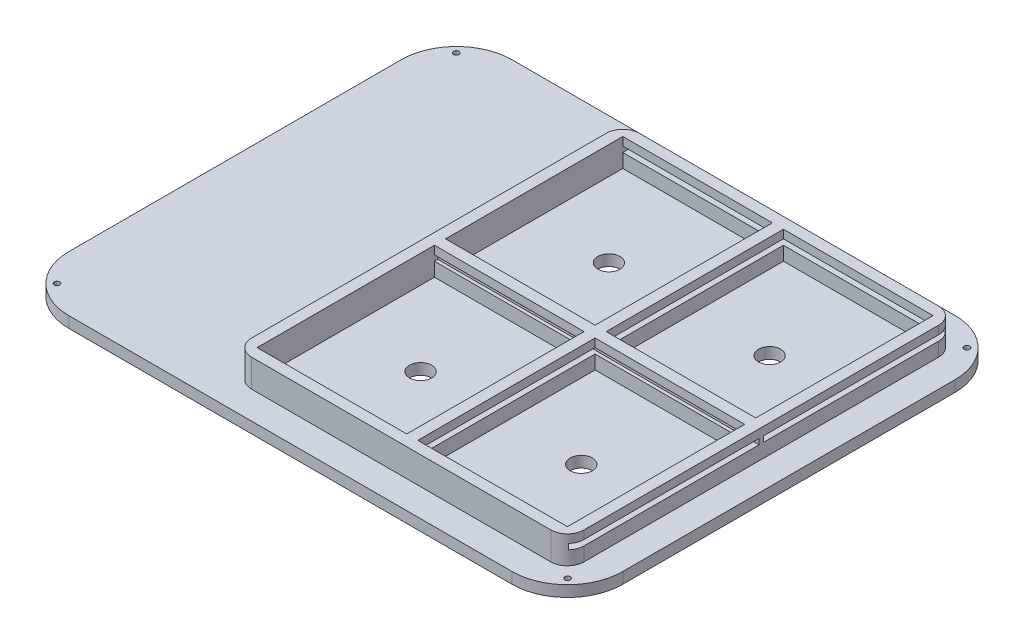
from build123d import *

# Parameters (mm, degrees)
SKETCH1_W           = 127
SKETCH1_H           = 101.6
BOSS_EXTRUDE1_DEPTH = 2.54
SKETCH2_W           = 76.2
SKETCH2_H           = 88.9
SKETCH2_W_2         = 34.29
SKETCH2_H_2         = 40.64
BOSS_EXTRUDE2_DEPTH = 6.35
SKETCH3_R           = 2.54
CUT_EXTRUDE1_DEPTH  = 163.763271348
CUT_EXTRUDE2_REACH  = 159.981
SKETCH4_W           = 42.672
SKETCH4_H           = 1.267041817
FILLET1_R           = 3.81
FILLET2_R           = 12.7
SKETCH5_R           = 0.635
CUT_EXTRUDE3_DEPTH  = 163.763271348


with BuildPart() as part:
    # Sketch1 → Boss-Extrude1 (new body)
    with BuildSketch(Plane(origin=(0, 0, 0), x_dir=(1, 0, 0), z_dir=(0, 1, 0))):
        with Locations((63.5, 50.8)):
            Rectangle(SKETCH1_W, SKETCH1_H)
    extrude(amount=BOSS_EXTRUDE1_DEPTH)

    # Sketch2 → Boss-Extrude2 (add)
    with BuildSketch(Plane(origin=(0, 2.54, 0), x_dir=(1, 0, 0), z_dir=(0, 1, 0))):
        with Locations((82.55, 50.8)):
            Rectangle(SKETCH2_W, SKETCH2_H)
        with Locations((64.135, 72.39)):
            Rectangle(SKETCH2_W_2, SKETCH2_H_2, mode=Mode.SUBTRACT)
        with Locations((64.135, 29.21)):
            Rectangle(SKETCH2_W_2, SKETCH2_H_2, mode=Mode.SUBTRACT)
        with Locations((100.965, 29.21)):
            Rectangle(SKETCH2_W_2, SKETCH2_H_2, mode=Mode.SUBTRACT)
        with Locations((100.965, 72.39)):
            Rectangle(SKETCH2_W_2, SKETCH2_H_2, mode=Mode.SUBTRACT)
    extrude(amount=BOSS_EXTRUDE2_DEPTH)

    # Sketch3 → Cut-Extrude1 (cut, through all)
    with BuildSketch(Plane(origin=(0, 2.54, 0), x_dir=(1, 0, 0), z_dir=(0, 1, 0))):
        with Locations(Location((64.135, 72.39, 0), (0, 0, 270))):
            Circle(SKETCH3_R)
        with Locations(Location((100.965, 72.39, 0), (0, 0, 270))):
            Circle(SKETCH3_R)
        with Locations(Location((64.135, 29.21, 0), (0, 0, 270))):
            Circle(SKETCH3_R)
        with Locations(Location((100.965, 29.21, 0), (0, 0, 270))):
            Circle(SKETCH3_R)
    extrude(amount=-CUT_EXTRUDE1_DEPTH, mode=Mode.SUBTRACT)

    # Cut-Extrude2: up to this face of the body (flat: up to its plane)
    cut_extrude2_end = Plane(part.part.faces().sort_by_distance((46.99, 5.715, -29.21))[0])
    # Sketch4 → Cut-Extrude2 (cut, up to the picked face)
    with BuildSketch(Plane(origin=(120.65, 0, 0), x_dir=(0, 0, -1), z_dir=(1, 0, 0)), mode=Mode.PRIVATE) as cut_extrude2_sk1:
        with Locations((72.644, 6.348520909)):
            Rectangle(SKETCH4_W, SKETCH4_H)
    cut_extrude2_tool1 = split(extrude(cut_extrude2_sk1.sketch, amount=-CUT_EXTRUDE2_REACH, mode=Mode.PRIVATE), bisect_by=cut_extrude2_end, keep=Keep.BOTH, mode=Mode.PRIVATE)
    # Sketch4 → Cut-Extrude2 (cut, up to the picked face)
    with BuildSketch(Plane(origin=(120.65, 0, 0), x_dir=(0, 0, -1), z_dir=(1, 0, 0)), mode=Mode.PRIVATE) as cut_extrude2_sk2:
        with Locations((28.956, 6.348520909)):
            Rectangle(SKETCH4_W, SKETCH4_H)
    cut_extrude2_tool2 = split(extrude(cut_extrude2_sk2.sketch, amount=-CUT_EXTRUDE2_REACH, mode=Mode.PRIVATE), bisect_by=cut_extrude2_end, keep=Keep.BOTH, mode=Mode.PRIVATE)
    add(cut_extrude2_tool1.solids().sort_by(Axis((120.65, 6.348521, -72.644), (-1, 0, 0)))[0], mode=Mode.SUBTRACT)
    add(cut_extrude2_tool2.solids().sort_by(Axis((120.65, 6.348521, -28.956), (-1, 0, 0)))[0], mode=Mode.SUBTRACT)

    # Fillet1
    # the kernel refuses this fillet: 3.81 mm, written as the material it takes off along each edge
    with BuildSketch(Plane(origin=(120.65, 2.54, -95.25), x_dir=(0, 0, 1), z_dir=(0, 1, 0)), Plane(origin=(120.65, 2.54, -6.35), x_dir=(-1, 0, 0), z_dir=(0, 1, 0)), Plane(origin=(44.45, 2.54, -6.35), x_dir=(0, 0, -1), z_dir=(0, 1, 0))) as fillet1_piece_1:
        with BuildLine():
            CenterArc((FILLET1_R, -FILLET1_R), FILLET1_R, 90, 90)
            Line((0, -FILLET1_R), (0, 0))
            Line((0, 0), (FILLET1_R, 0))
        make_face()
    extrude(amount=15.875, mode=Mode.SUBTRACT)
    with BuildSketch(Plane(origin=(44.45, 2.54, -95.25), x_dir=(0, 0, 1), z_dir=(0, 1, 0))) as fillet1_piece_2:
        with BuildLine():
            CenterArc((FILLET1_R, FILLET1_R), FILLET1_R, 180, 90)
            Line((0, FILLET1_R), (0, 0))
            Line((0, 0), (FILLET1_R, 0))
        make_face()
    extrude(amount=15.875, mode=Mode.SUBTRACT)

    # Fillet2
    fillet2_edges = [part.edges().sort_by_distance(p)[0] for p in [
        (0, 1.27, -101.6),
        (127, 1.27, -101.6),
        (127, 1.27, 0),
        (0, 1.27, 0),
    ]]
    fillet(fillet2_edges, radius=FILLET2_R)

    # Sketch5 → Cut-Extrude3 (cut, through all)
    with BuildSketch(Plane(origin=(0, 2.54, 0), x_dir=(1, 0, 0), z_dir=(0, 1, 0))):
        with Locations(Location((4.963162708, 5.024067494, 0), (0, 0, 270))):
            Circle(SKETCH5_R)
        with Locations(Location((122.036837292, 5.024067494, 0), (0, 0, 90))):
            Circle(SKETCH5_R)
        with Locations(Location((122.036837292, 96.575932506, 0), (0, 0, 270))):
            Circle(SKETCH5_R)
        with Locations(Location((4.963162708, 96.575932506, 0), (0, 0, 90))):
            Circle(SKETCH5_R)
    extrude(amount=-CUT_EXTRUDE3_DEPTH, mode=Mode.SUBTRACT)


solid = part.part
